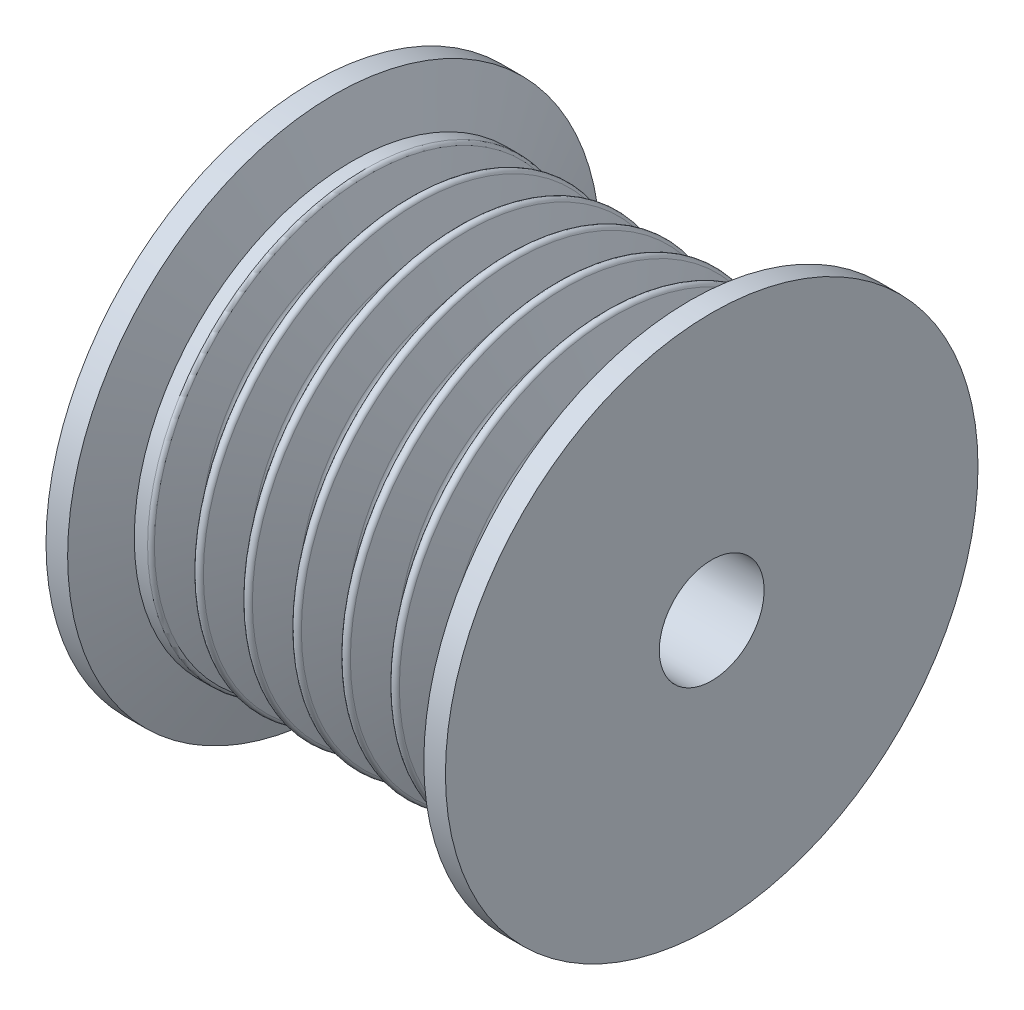
from build123d import *

# Parameters (mm, degrees)
SKETCH1_W       = 19.05
SKETCH1_H       = 10.200000047
LPATTERN1_COUNT = 6
LPATTERN1_PITCH = 2.3368


with BuildPart() as part:
    # Sketch1 → Revolve1 (revolve)
    with BuildSketch(Plane.XY):
        with Locations((9.525, 7.599999977)):
            Rectangle(SKETCH1_W, SKETCH1_H)
    revolve(axis=Axis((0, 0, 0), (1, 0, 0)))

    # Sketch2 → Cut-Revolve1 (revolve, cut)
    with BuildSketch(Plane.XY):
        with BuildLine():
            Line((14.1986, 12.7), (14.1986, 10.369901507))
            ThreePointArc((14.1986, 10.369901507), (14.315150732, 10.333153202), (14.389545541, 10.2362))
            Line((14.389545541, 10.2362), (14.985108919, 8.599903066))
            ThreePointArc((14.985108919, 8.599903066), (15.367, 8.332500052), (15.748891081, 8.599903066))
            Line((15.748891081, 8.599903066), (16.344454459, 10.2362))
            ThreePointArc((16.344454459, 10.2362), (16.418849268, 10.333153202), (16.5354, 10.369901507))
            Line((16.5354, 10.369901507), (16.5354, 12.7))
            Line((16.5354, 12.7), (14.1986, 12.7))
        make_face()
    cut_revolve1 = revolve(axis=Axis((0, 0, 0), (1, 0, 0)), mode=Mode.SUBTRACT)

    # LPattern1: Cut-Revolve1 ×6
    with Locations(*[(-i * LPATTERN1_PITCH, 0, 0) for i in range(1, LPATTERN1_COUNT)]):
        add(cut_revolve1, mode=Mode.SUBTRACT)

    # Sketch3 → Cut-Revolve2 (revolve, cut)
    with BuildSketch(Plane.XY):
        Polygon((16.5354, 12.7), (18.018486494, 12.7), (17.1704, 10.369901507), (16.5354, 10.369901507), align=None)
        Polygon((2.5146, 10.369901507), (2.5146, 12.7), (1.031513506, 12.7), (1.8796, 10.369901507), align=None)
    revolve(axis=Axis((0, 0, 0), (1, 0, 0)), mode=Mode.SUBTRACT)


solid = part.part
